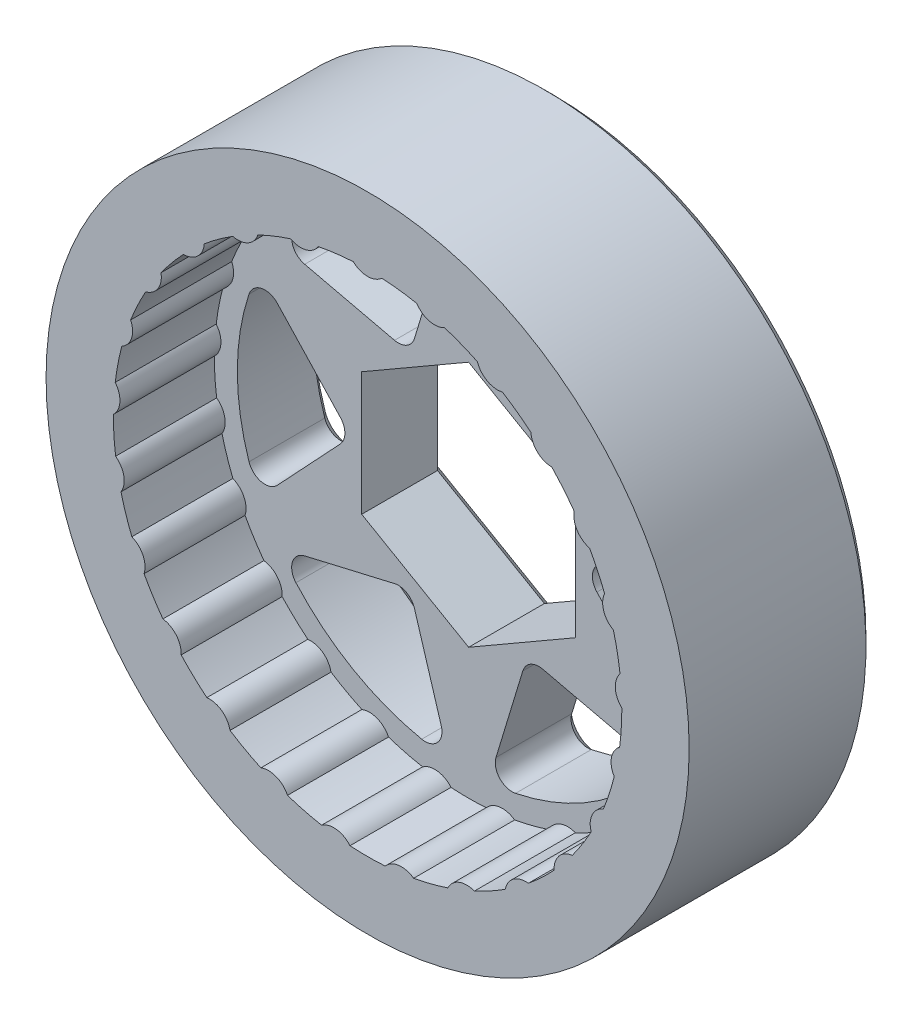
from build123d import *

# Parameters (mm, degrees)
DIAL_PROFILE_SKETCH_R        = 19.1
DIAL_PROFILE_EXTRUSION_DEPTH = 6
BOSS_EXTRUDE1_START          = 5
SOCKET_TOP_SKETCH_R          = 19.1
BOSS_EXTRUDE1_DEPTH          = 5
CHAMFER1_SIZE                = 0.5


with BuildPart() as part:
    # Dial Profile Sketch → Dial Profile Extrusion (new body)
    with BuildSketch(Plane.XY):
        Circle(DIAL_PROFILE_SKETCH_R)
        with BuildLine():
            ThreePointArc((-0.85, 15.076057177), (0, 14.742572316), (0.85, 15.076057177))
            ThreePointArc((0.85, 15.076057177), (1.892531827, 14.98093199), (2.925967271, 14.813801522))
            ThreePointArc((2.925967271, 14.813801522), (3.666328646, 14.279407297), (4.572558645, 14.391028714))
            ThreePointArc((4.572558645, 14.391028714), (5.558680746, 14.039624937), (6.518085258, 13.620740236))
            ThreePointArc((6.518085258, 13.620740236), (7.102288379, 12.919014601), (8.007806614, 12.80175899))
            ThreePointArc((8.007806614, 12.80175899), (8.87555731, 12.216156615), (9.700647976, 11.571837747))
            ThreePointArc((9.700647976, 11.571837747), (10.091985213, 10.746872706), (10.939894643, 10.408107667))
            ThreePointArc((10.939894643, 10.408107667), (11.634749966, 9.625102245), (12.273683305, 8.795834135))
            ThreePointArc((12.273683305, 8.795834135), (12.4475655, 7.899465274), (13.184588857, 7.360476661))
            ThreePointArc((13.184588857, 7.360476661), (13.662888492, 6.429267303), (14.075517973, 5.467155915))
            ThreePointArc((14.075517973, 5.467155915), (14.021019468, 4.555705386), (14.600846863, 3.850359837))
            ThreePointArc((14.600846863, 3.850359837), (14.832537486, 2.82945785), (14.99293608, 1.794956182))
            ThreePointArc((14.99293608, 1.794956182), (14.713481217, 0.925693775), (15.099679963, 0.098310743))
            ThreePointArc((15.099679963, 0.098310743), (15.070203599, -0.948136845), (14.968292873, -1.990027249))
            ThreePointArc((14.968292873, -1.990027249), (14.481440829, -2.762482581), (14.649744639, -3.659915576))
            ThreePointArc((14.649744639, -3.659915576), (14.360953396, -4.666156615), (14.003136776, -5.64996995))
            ThreePointArc((14.003136776, -5.64996995), (13.339478254, -6.277081996), (13.27931198, -7.188175939))
            ThreePointArc((13.27931198, -7.188175939), (12.749351675, -8.090984604), (12.158112095, -8.954904259))
            ThreePointArc((12.158112095, -8.954904259), (11.359347202, -9.397269265), (11.074491312, -10.264776772))
            ThreePointArc((11.074491312, -10.264776772), (10.3366613, -11.007426274), (9.549148516, -11.697169))
            ThreePointArc((9.549148516, -11.697169), (8.665466588, -11.926991544), (8.173819626, -12.696403929))
            ThreePointArc((8.173819626, -12.696403929), (7.274480479, -13.232230869), (6.340176817, -13.704457593))
            ThreePointArc((6.340176817, -13.704457593), (5.427102839, -13.707297081), (4.759556791, -14.330269333))
            ThreePointArc((4.759556791, -14.330269333), (3.755217296, -14.625605733), (2.732828491, -14.850644714))
            ThreePointArc((2.732828491, -14.850644714), (1.847734259, -14.62632273), (1.046233499, -15.063711212))
            ThreePointArc((1.046233499, -15.063711212), (0, -15.1), (-1.046233499, -15.063711212))
            ThreePointArc((-1.046233499, -15.063711212), (-1.847734259, -14.62632273), (-2.732828491, -14.850644714))
            ThreePointArc((-2.732828491, -14.850644714), (-3.755217296, -14.625605733), (-4.759556791, -14.330269333))
            ThreePointArc((-4.759556791, -14.330269333), (-5.427102839, -13.707297081), (-6.340176817, -13.704457593))
            ThreePointArc((-6.340176817, -13.704457593), (-7.274480479, -13.232230869), (-8.173819626, -12.696403929))
            ThreePointArc((-8.173819626, -12.696403929), (-8.665466588, -11.926991544), (-9.549148516, -11.697169))
            ThreePointArc((-9.549148516, -11.697169), (-10.3366613, -11.007426274), (-11.074491312, -10.264776772))
            ThreePointArc((-11.074491312, -10.264776772), (-11.359347202, -9.397269265), (-12.158112095, -8.954904259))
            ThreePointArc((-12.158112095, -8.954904259), (-12.749351675, -8.090984604), (-13.27931198, -7.188175939))
            ThreePointArc((-13.27931198, -7.188175939), (-13.339478254, -6.277081996), (-14.003136776, -5.64996995))
            ThreePointArc((-14.003136776, -5.64996995), (-14.360953396, -4.666156615), (-14.649744639, -3.659915576))
            ThreePointArc((-14.649744639, -3.659915576), (-14.481440829, -2.762482581), (-14.968292873, -1.990027249))
            ThreePointArc((-14.968292873, -1.990027249), (-15.070203599, -0.948136845), (-15.099679963, 0.098310743))
            ThreePointArc((-15.099679963, 0.098310743), (-14.713481217, 0.925693775), (-14.99293608, 1.794956182))
            ThreePointArc((-14.99293608, 1.794956182), (-14.832537486, 2.82945785), (-14.600846863, 3.850359837))
            ThreePointArc((-14.600846863, 3.850359837), (-14.021019468, 4.555705386), (-14.075517973, 5.467155915))
            ThreePointArc((-14.075517973, 5.467155915), (-13.662888492, 6.429267303), (-13.184588857, 7.360476661))
            ThreePointArc((-13.184588857, 7.360476661), (-12.4475655, 7.899465274), (-12.273683305, 8.795834135))
            ThreePointArc((-12.273683305, 8.795834135), (-11.634749966, 9.625102245), (-10.939894643, 10.408107667))
            ThreePointArc((-10.939894643, 10.408107667), (-10.091985213, 10.746872706), (-9.700647976, 11.571837747))
            ThreePointArc((-9.700647976, 11.571837747), (-8.87555731, 12.216156615), (-8.007806614, 12.80175899))
            ThreePointArc((-8.007806614, 12.80175899), (-7.102288379, 12.919014601), (-6.518085258, 13.620740236))
            ThreePointArc((-6.518085258, 13.620740236), (-5.558680746, 14.039624937), (-4.572558645, 14.391028714))
            ThreePointArc((-4.572558645, 14.391028714), (-3.666328646, 14.279407297), (-2.925967271, 14.813801522))
            ThreePointArc((-2.925967271, 14.813801522), (-1.892531827, 14.98093199), (-0.85, 15.076057177))
        make_face(mode=Mode.SUBTRACT)
    extrude(amount=DIAL_PROFILE_EXTRUSION_DEPTH)

    # Socket Top Sketch → Boss-Extrude1 (add)
    with BuildSketch(Plane(origin=(0, 0, 0), x_dir=(-1, 0, 0), z_dir=(0, 0, -1)).offset(BOSS_EXTRUDE1_START)):
        Circle(SOCKET_TOP_SKETCH_R)
        with BuildLine():
            Line((-1.626412403, 12.183897348), (-3.218122555, 6.940820202))
            ThreePointArc((-3.218122555, 6.940820202), (-3.675, 6.365286718), (-4.401865341, 6.257385986))
            Line((-4.401865341, 6.257385986), (-9.738358419, 7.500463132))
            ThreePointArc((-9.738358419, 7.500463132), (-10.464716593, 8.172122942), (-10.258132896, 9.139617786))
            ThreePointArc((-10.258132896, 9.139617786), (-6.86953244, 11.898379211), (-2.786074736, 13.453612576))
            ThreePointArc((-2.786074736, 13.453612576), (-1.844907774, 13.148771884), (-1.626412403, 12.183897348))
        make_face(mode=Mode.SUBTRACT)
        Polygon((0, 7.332348419), (-6.35, 3.666174209), (-6.35, -3.666174209), (0, -7.332348419), (6.35, -3.666174209), (6.35, 3.666174209), align=None, mode=Mode.SUBTRACT)
        with BuildLine():
            Line((3.218122555, 6.940820202), (1.626412403, 12.183897348))
            ThreePointArc((1.626412403, 12.183897348), (1.844907774, 13.148771884), (2.786074736, 13.453612576))
            ThreePointArc((2.786074736, 13.453612576), (6.86953244, 11.898379211), (10.258132896, 9.139617786))
            ThreePointArc((10.258132896, 9.139617786), (10.464716593, 8.172122942), (9.738358419, 7.500463132))
            Line((9.738358419, 7.500463132), (4.401865341, 6.257385986))
            ThreePointArc((4.401865341, 6.257385986), (3.675, 6.365286718), (3.218122555, 6.940820202))
        make_face(mode=Mode.SUBTRACT)
        with BuildLine():
            Line((7.619987896, 0.683434216), (11.364770822, 4.683434216))
            ThreePointArc((11.364770822, 4.683434216), (12.309624367, 4.976648942), (13.044207632, 4.31399479))
            ThreePointArc((13.044207632, 4.31399479), (13.73906488, 0), (13.044207632, -4.31399479))
            ThreePointArc((13.044207632, -4.31399479), (12.309624367, -4.976648942), (11.364770822, -4.683434216))
            Line((11.364770822, -4.683434216), (7.619987896, -0.683434216))
            ThreePointArc((7.619987896, -0.683434216), (7.35, 0), (7.619987896, 0.683434216))
        make_face(mode=Mode.SUBTRACT)
        with BuildLine():
            Line((4.401865341, -6.257385986), (9.738358419, -7.500463132))
            ThreePointArc((9.738358419, -7.500463132), (10.464716593, -8.172122942), (10.258132896, -9.139617786))
            ThreePointArc((10.258132896, -9.139617786), (6.86953244, -11.898379211), (2.786074736, -13.453612576))
            ThreePointArc((2.786074736, -13.453612576), (1.844907774, -13.148771884), (1.626412403, -12.183897348))
            Line((1.626412403, -12.183897348), (3.218122555, -6.940820202))
            ThreePointArc((3.218122555, -6.940820202), (3.675, -6.365286718), (4.401865341, -6.257385986))
        make_face(mode=Mode.SUBTRACT)
        with BuildLine():
            Line((-3.218122555, -6.940820202), (-1.626412403, -12.183897348))
            ThreePointArc((-1.626412403, -12.183897348), (-1.844907774, -13.148771884), (-2.786074736, -13.453612576))
            ThreePointArc((-2.786074736, -13.453612576), (-6.86953244, -11.898379211), (-10.258132896, -9.139617786))
            ThreePointArc((-10.258132896, -9.139617786), (-10.464716593, -8.172122942), (-9.738358419, -7.500463132))
            Line((-9.738358419, -7.500463132), (-4.401865341, -6.257385986))
            ThreePointArc((-4.401865341, -6.257385986), (-3.675, -6.365286718), (-3.218122555, -6.940820202))
        make_face(mode=Mode.SUBTRACT)
        with BuildLine():
            Line((-7.619987896, -0.683434216), (-11.364770822, -4.683434216))
            ThreePointArc((-11.364770822, -4.683434216), (-12.309624367, -4.976648942), (-13.044207632, -4.31399479))
            ThreePointArc((-13.044207632, -4.31399479), (-13.73906488, 0), (-13.044207632, 4.31399479))
            ThreePointArc((-13.044207632, 4.31399479), (-12.309624367, 4.976648942), (-11.364770822, 4.683434216))
            Line((-11.364770822, 4.683434216), (-7.619987896, 0.683434216))
            ThreePointArc((-7.619987896, 0.683434216), (-7.35, 0), (-7.619987896, -0.683434216))
        make_face(mode=Mode.SUBTRACT)
    extrude(amount=-BOSS_EXTRUDE1_DEPTH)

    # Chamfer1
    chamfer1_edges = [part.edges().sort_by_distance(p)[0] for p in [
        (-3.675, 6.365286718, -5),
        (-2.422267479, 9.562358775, -5),
        (-6.86953244, 11.898379211, -5),
        (-10.464716593, 8.172122942, -5),
        (-7.07011188, 6.878924559, -5),
        (-3.675, -6.365286718, -5),
        (-7.07011188, -6.878924559, -5),
        (-6.86953244, -11.898379211, -5),
        (-1.844907774, -13.148771884, -5),
        (-2.422267479, -9.562358775, -5),
        (-7.35, 0, -5),
        (-9.492379359, 2.683434216, -5),
        (-13.73906488, 0, -5),
        (-12.309624367, -4.976648942, -5),
        (-9.492379359, -2.683434216, -5),
        (3.675, 6.365286718, -5),
        (7.07011188, 6.878924559, -5),
        (6.86953244, 11.898379211, -5),
        (1.844907774, 13.148771884, -5),
        (2.422267479, 9.562358775, -5),
        (7.35, 0, -5),
        (9.492379359, -2.683434216, -5),
        (13.73906488, 0, -5),
        (12.309624367, 4.976648942, -5),
        (9.492379359, 2.683434216, -5),
        (3.675, -6.365286718, -5),
        (2.422267479, -9.562358775, -5),
        (6.86953244, -11.898379211, -5),
        (10.464716593, -8.172122942, -5),
        (7.07011188, -6.878924559, -5),
        (19.1, 0, -5),
        (1.844907774, -13.148771884, -5),
        (12.309624367, -4.976648942, -5),
        (10.464716593, 8.172122942, -5),
        (-3.175, 5.499261314, -5),
        (3.175, 5.499261314, -5),
        (6.35, 0, -5),
        (3.175, -5.499261314, -5),
        (-3.175, -5.499261314, -5),
        (-6.35, 0, -5),
        (-12.309624367, 4.976648942, -5),
        (-10.464716593, -8.172122942, -5),
        (-1.844907774, 13.148771884, -5),
    ]]
    chamfer(chamfer1_edges, length=CHAMFER1_SIZE - 0.0001)  # a hair under: the kernel refuses the full size


solid = part.part
